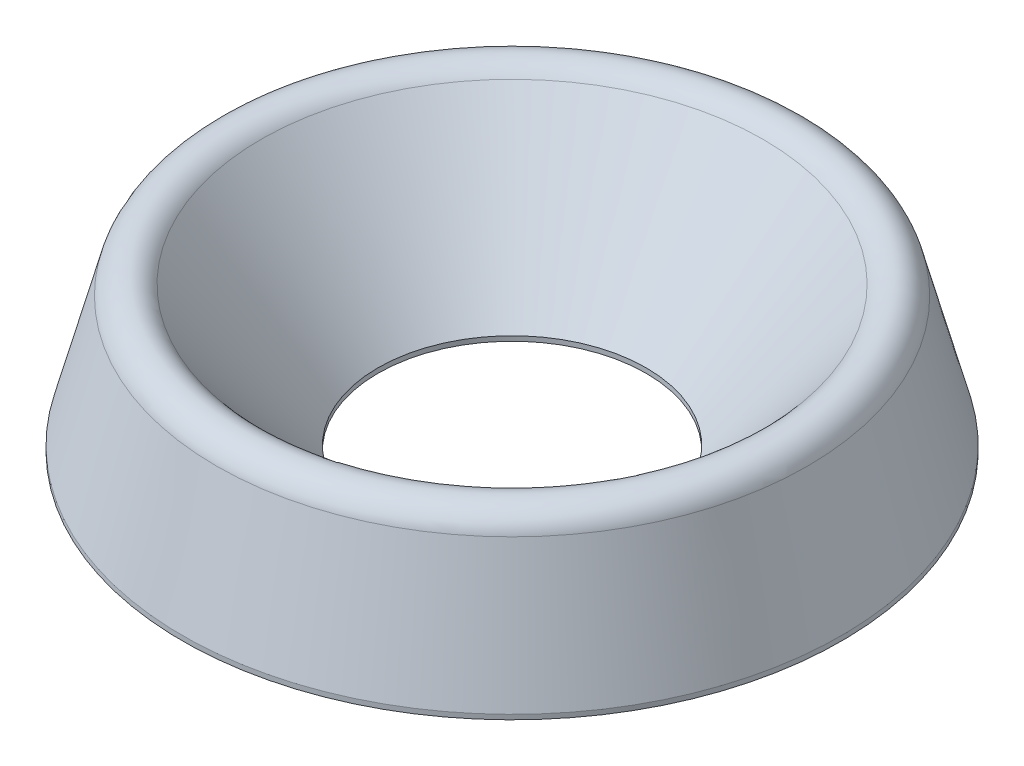
from build123d import *


# Read off the part's stored shape, not the designer's step: Shell2
with BuildPart() as part:
    # Sketch1 → Revolve1 (revolve)
    with BuildSketch(Plane.XY, mode=Mode.PRIVATE) as revolve1_sk:
        with BuildLine():
            Line((-8.7376, 0), (-8.7376, 0.127))
            Line((-8.7376, 0.127), (-7.830223739, 3.559760253))
            ThreePointArc((-7.830223739, 3.559760253), (-7.323100489, 4.047695704), (-6.656513532, 3.822048141))
            Line((-6.656513532, 3.822048141), (-3.556, 0.127))
            Line((-3.556, 0.127), (-3.556, 0))
            Line((-3.556, 0), (-8.7376, 0))
        make_face()
    revolve(revolve1_sk.sketch.rotate(Axis((0, 0, 0), (0, 1, 0)), 270), axis=Axis((0, 0, 0), (0, 1, 0)))

    # Shell2 outline → Shell2 (revolve, cut)
    with BuildSketch(Plane.XY):
        Polygon((7.120216638, 3.139812195), (4.485601383, 0), (7.94385, 0), (7.94385, 0.023865712), align=None)
    revolve(axis=Axis((0, 0, 0), (0, 1, 0)), mode=Mode.SUBTRACT)


solid = part.part
